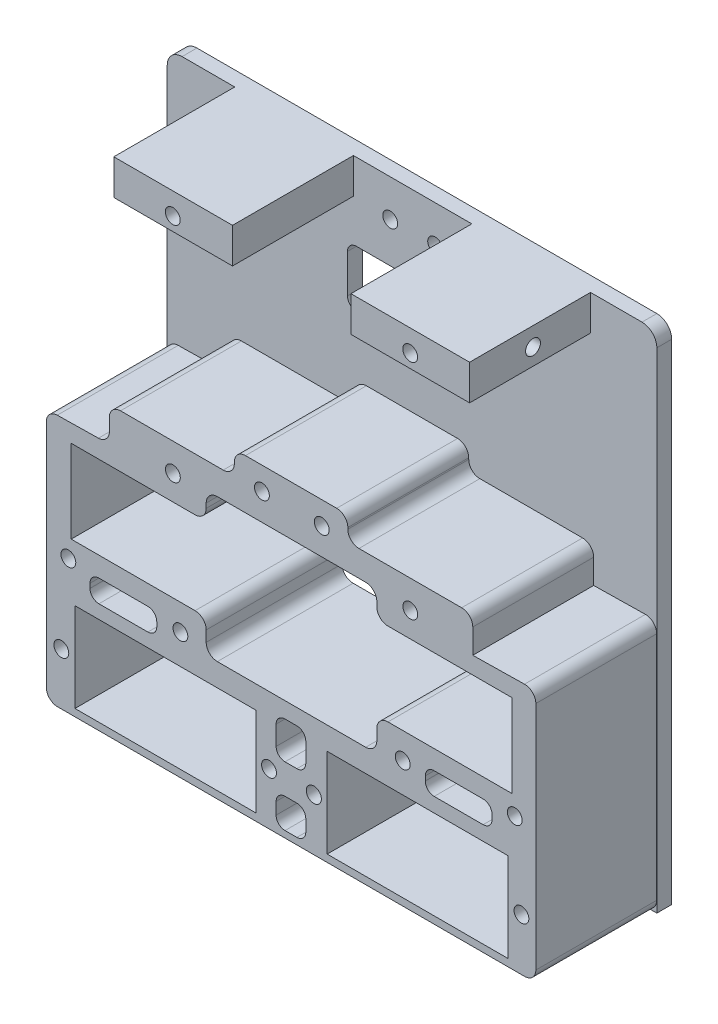
from build123d import *

# Parameters (mm, degrees)
SKETCH1_W           = 66
SKETCH1_H           = 68
SKETCH1_R           = 1
SKETCH1_W_2         = 17.8
SKETCH1_H_2         = 7.6
BOSS_EXTRUDE1_DEPTH = 2
SKETCH2_W           = 16
SKETCH2_H           = 4.75
BOSS_EXTRUDE2_DEPTH = 16.3
BOSS_EXTRUDE3_DEPTH = 16.3
SKETCH4_W           = 24.4
SKETCH4_H           = 12
CUT_EXTRUDE1_DEPTH  = 441.19004389
SKETCH5_W           = 9
SKETCH5_H           = 3
CUT_EXTRUDE2_DEPTH  = 441.19004389
SKETCH6_W           = 4
SKETCH6_H           = 5
SKETCH6_H_2         = 4
CUT_EXTRUDE3_DEPTH  = 441.19004389
SKETCH7_R           = 1
SKETCH7_R_2         = 1.021070593
CUT_EXTRUDE4_DEPTH  = 441.19004389
FILLET1_R           = 1.5
FILLET2_R           = 1.2
FILLET3_R           = 2
SKETCH8_R           = 1
CUT_EXTRUDE5_DEPTH  = 441.19004389
SKETCH9_R           = 1
CUT_EXTRUDE6_DEPTH  = 6.5
SKETCH10_R          = 1
CUT_EXTRUDE7_DEPTH  = 6.5


with BuildPart() as part:
    # Sketch1 → Boss-Extrude1 (new body)
    with BuildSketch(Plane.XY.offset(30)):
        with Locations((251.940861289, 301.024014524)):
            Rectangle(SKETCH1_W, SKETCH1_H)
        with Locations((249.003592831, 330.031505481)):
            Circle(SKETCH1_R, mode=Mode.SUBTRACT)
        with Locations((255.055282531, 330.031505481)):
            Circle(SKETCH1_R, mode=Mode.SUBTRACT)
        with Locations((252.135035756, 320.823888471)):
            Rectangle(SKETCH1_W_2, SKETCH1_H_2, mode=Mode.SUBTRACT)
    extrude(amount=BOSS_EXTRUDE1_DEPTH)

    # Sketch2 → Boss-Extrude2 (add)
    with BuildSketch(Plane.XY.offset(32)):
        with Locations((236.037971242, 332.649014524)):
            Rectangle(SKETCH2_W, SKETCH2_H)
        with Locations((268, 332.649014524)):
            Rectangle(SKETCH2_W, SKETCH2_H)
    extrude(amount=BOSS_EXTRUDE2_DEPTH)

    # Sketch3 → Boss-Extrude3 (add)
    with BuildSketch(Plane.XY.offset(32)):
        Polygon((218.940861289, 301.024014524), (227.440861289, 301.162994385), (227.440861289, 305.822042144), (244.283938871, 305.822042144), (244.283938871, 309.015037829), (259.583938871, 309.015037829), (259.583938871, 305.822042144), (276.427016453, 305.822042144), (276.427016453, 301.022054351), (284.927016453, 301.161034212), (284.927016453, 267.024014524), (218.940861289, 267.024014524), align=None)
    extrude(amount=BOSS_EXTRUDE3_DEPTH)

    # Sketch4 → Cut-Extrude1 (cut, through all)
    with BuildSketch(Plane.XY.offset(48.3)):
        Polygon((222.292892456, 298.707092285), (240.492892456, 298.707092285), (240.492892456, 302.33213739), (263.492892456, 302.33213739), (263.492892456, 298.718047727), (281.692892456, 298.718047727), (281.692892456, 287.526982505), (263.492892456, 287.526982505), (263.492892456, 283.070220947), (240.492892456, 283.070220947), (240.492892456, 287.516027063), (222.292892456, 287.516027063), align=None)
        with Locations((269.000012207, 274)):
            Rectangle(SKETCH4_W, SKETCH4_H)
        with Locations((235.000003052, 274)):
            Rectangle(SKETCH4_W, SKETCH4_H)
    extrude(amount=-CUT_EXTRUDE1_DEPTH, mode=Mode.SUBTRACT)

    # Sketch5 → Cut-Extrude2 (cut, through all)
    with BuildSketch(Plane.XY.offset(48.3)):
        with Locations((274.525158894, 283.446375987)):
            Rectangle(SKETCH5_W, SKETCH5_H)
        with Locations((229.329304238, 283.337005615)):
            Rectangle(SKETCH5_W, SKETCH5_H)
    extrude(amount=-CUT_EXTRUDE2_DEPTH, mode=Mode.SUBTRACT)

    # Sketch6 → Cut-Extrude3 (cut, through all)
    with BuildSketch(Plane.XY.offset(48.3)):
        with Locations((251.916786234, 278.429140424)):
            Rectangle(SKETCH6_W, SKETCH6_H)
        with Locations((251.916786234, 269.906464851)):
            Rectangle(SKETCH6_W, SKETCH6_H_2)
    extrude(amount=-CUT_EXTRUDE3_DEPTH, mode=Mode.SUBTRACT)

    # Sketch7 → Cut-Extrude4 (cut, through all)
    with BuildSketch(Plane.XY.offset(48.3)):
        with Locations((248.003059288, 305.943814451)):
            Circle(SKETCH7_R)
        with Locations((256.067937584, 305.943814451)):
            Circle(SKETCH7_R)
        with Locations((268.009326043, 302.047231613)):
            Circle(SKETCH7_R)
        with Locations((235.999760795, 302.047231613)):
            Circle(SKETCH7_R)
        with Locations((221.910888085, 285.07153078)):
            Circle(SKETCH7_R)
        with Locations((237.015406487, 284.015838633)):
            Circle(SKETCH7_R)
        with Locations((220.965503346, 274.032606797)):
            Circle(SKETCH7_R)
        with Locations((248.961423741, 274.032606797)):
            Circle(SKETCH7_R)
        with Locations((254.999359262, 274.032606797)):
            Circle(SKETCH7_R_2)
        with Locations((266.989260963, 284.015838633)):
            Circle(SKETCH7_R)
        with Locations((282.088512959, 285.07153078)):
            Circle(SKETCH7_R)
        with Locations((282.98591942, 274.032606797)):
            Circle(SKETCH7_R)
    extrude(amount=-CUT_EXTRUDE4_DEPTH, mode=Mode.SUBTRACT)

    # Fillet1
    fillet1_edges = [part.edges().sort_by_distance(p)[0] for p in [
        (240.492892456, 287.516027063, 39.15),
        (240.492892456, 283.070220947, 39.15),
        (263.492892456, 283.070220947, 39.15),
        (263.492892456, 287.526982505, 39.15),
        (240.492892456, 298.707092285, 39.15),
        (240.492892456, 302.33213739, 39.15),
        (263.492892456, 298.718047727, 39.15),
        (263.492892456, 302.33213739, 39.15),
        (244.283938871, 305.822042144, 40.15),
        (244.283938871, 309.015037829, 40.15),
        (259.583938871, 309.015037829, 40.15),
        (259.583938871, 305.822042144, 40.15),
        (227.440861289, 301.162994385, 40.15),
        (227.440861289, 305.822042144, 40.15),
        (218.940861289, 301.024014524, 40.15),
        (218.940861289, 267.024014524, 39.15),
        (284.927016453, 267.024014524, 40.15),
        (284.927016453, 301.161034212, 40.15),
        (276.427016453, 305.822042144, 40.15),
    ]]
    fillet(fillet1_edges, radius=FILLET1_R)

    # Fillet2
    fillet2_edges = [part.edges().sort_by_distance(p)[0] for p in [
        (253.916786234, 275.929140424, 39.15),
        (253.916786234, 267.906464851, 39.15),
        (249.916786234, 267.906464851, 39.15),
        (249.916786234, 275.929140424, 39.15),
        (253.916786234, 271.906464851, 39.15),
        (253.916786234, 280.929140424, 39.15),
        (249.916786234, 271.906464851, 39.15),
        (249.916786234, 280.929140424, 39.15),
        (224.829304238, 284.837005615, 39.15),
        (233.829304238, 284.837005615, 39.15),
        (233.829304238, 281.837005615, 39.15),
        (224.829304238, 281.837005615, 39.15),
        (270.025158894, 281.946375987, 39.15),
        (270.025158894, 284.946375987, 39.15),
        (279.025158894, 281.946375987, 39.15),
        (279.025158894, 284.946375987, 39.15),
        (243.235035756, 317.023888471, 31),
        (261.035035756, 317.023888471, 31),
        (261.035035756, 324.623888471, 31),
        (243.235035756, 324.623888471, 31),
    ]]
    fillet(fillet2_edges, radius=FILLET2_R)

    # Fillet3
    fillet3_edges = [part.edges().sort_by_distance(p)[0] for p in [
        (284.940861289, 335.024014524, 31),
        (218.940861289, 335.024014524, 31),
    ]]
    fillet(fillet3_edges, radius=FILLET3_R)

    # Sketch8 → Cut-Extrude5 (cut, through all)
    with BuildSketch(Plane.XY.offset(48.3)):
        with Locations((267.990854058, 332.085596795)):
            Circle(SKETCH8_R)
        with Locations((235.98446718, 332.085596795)):
            Circle(SKETCH8_R)
    extrude(amount=-CUT_EXTRUDE5_DEPTH, mode=Mode.SUBTRACT)

    # Sketch9 → Cut-Extrude6 (cut)
    with BuildSketch(Plane.ZY.offset(-228.037971242)):
        with Locations((39.737317207, 332.521446832)):
            Circle(SKETCH9_R)
        with Locations((39.737317207, 303.185559602)):
            Circle(SKETCH9_R)
    extrude(amount=-CUT_EXTRUDE6_DEPTH, mode=Mode.SUBTRACT)

    # Sketch10 → Cut-Extrude7 (cut)
    with BuildSketch(Plane(origin=(276, 0, 0), x_dir=(0, 0, -1), z_dir=(1, 0, 0))):
        with Locations((-39.750621675, 332.516774296)):
            Circle(SKETCH10_R)
    extrude(amount=-CUT_EXTRUDE7_DEPTH, mode=Mode.SUBTRACT)


solid = part.part
